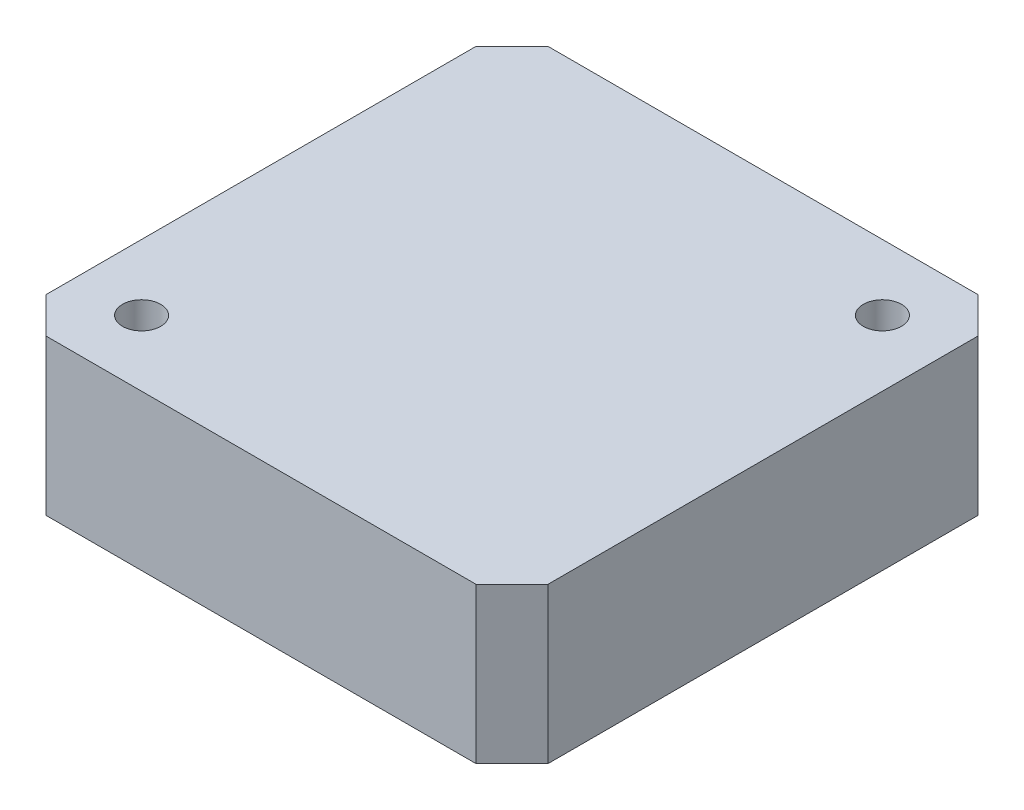
from build123d import *

# Parameters (mm, degrees)
CROQUIS1_W              = 42
CROQUIS1_H              = 42
SALIENTE_EXTRUIR1_DEPTH = 13
CHAFL_N1_SIZE           = 3
CROQUIS4_R              = 1.6
CORTAR_EXTRUIR2_DEPTH   = 33.419130155


with BuildPart() as part:
    # Croquis1 → Saliente-Extruir1 (new body)
    with BuildSketch(Plane(origin=(0, 0, 0), x_dir=(1, 0, 0), z_dir=(0, 1, 0))):
        Rectangle(CROQUIS1_W, CROQUIS1_H)
    extrude(amount=SALIENTE_EXTRUIR1_DEPTH)

    # Chaflán1
    chafl_n1_edges = [part.edges().sort_by_distance(p)[0] for p in [
        (-21, 6.5, -21),
        (21, 6.5, -21),
        (21, 6.5, 21),
        (-21, 6.5, 21),
    ]]
    chamfer(chafl_n1_edges, length=CHAFL_N1_SIZE)

    # Croquis4 → Cortar-Extruir2 (cut, through all)
    with BuildSketch(Plane(origin=(0, 13, 0), x_dir=(1, 0, 0), z_dir=(0, 1, 0))):
        with Locations((15.5, 15.5)):
            Circle(CROQUIS4_R)
        with Locations((-15.5, -15.5)):
            Circle(CROQUIS4_R)
    extrude(amount=-CORTAR_EXTRUIR2_DEPTH, mode=Mode.SUBTRACT)


solid = part.part
